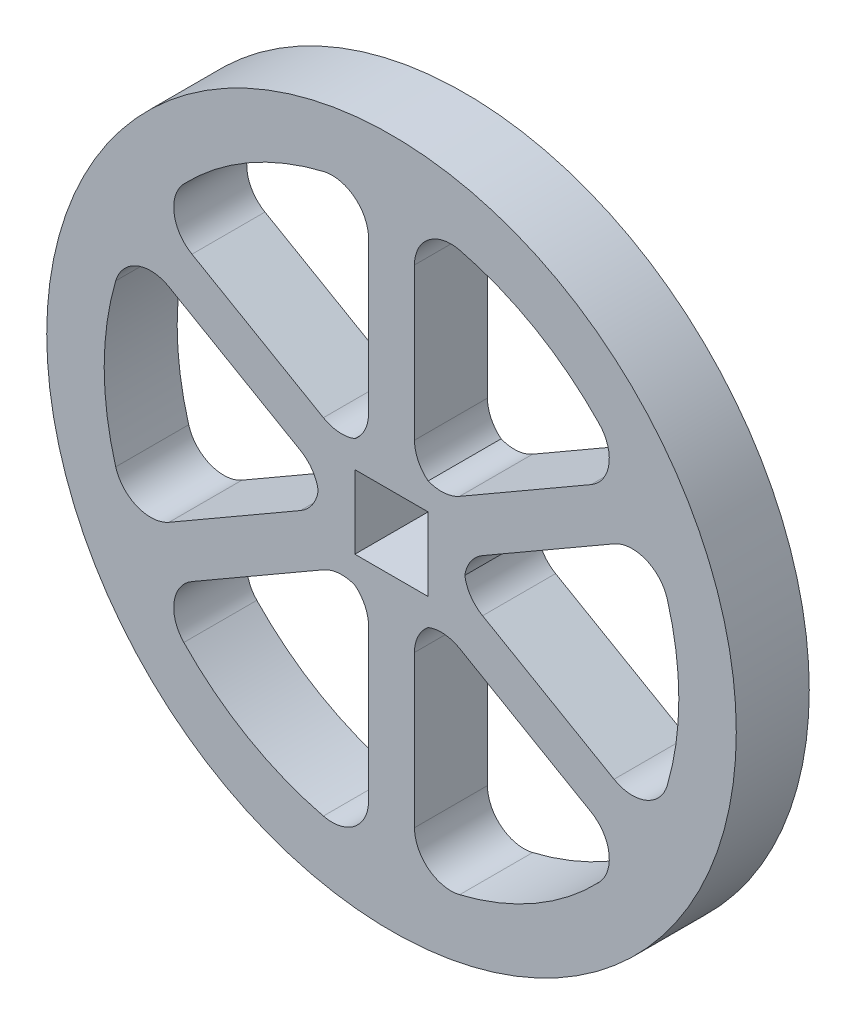
from build123d import *

# Parameters (mm, degrees)
SKETCH1_R           = 30
BOSS_EXTRUDE1_DEPTH = 6.35
FILLET1_R           = 3.175
SKETCH2_W           = 6.3754
SKETCH2_H           = 6.3754
CUT_EXTRUDE1_DEPTH  = 17.462


with BuildPart() as part:
    # Sketch1 → Boss-Extrude1 (new body)
    with BuildSketch(Plane.XY):
        Circle(SKETCH1_R)
        with BuildLine():
            Line((-2, 24.919871589), (-2, 6.026815079))
            ThreePointArc((-2, 6.026815079), (-3.175, 5.499261314), (-4.219374963, 4.745458347))
            Line((-4.219374963, 4.745458347), (-20.581241855, 14.191986602))
            ThreePointArc((-20.581241855, 14.191986602), (-12.5, 21.650635095), (-2, 24.919871589))
        make_face(mode=Mode.SUBTRACT)
        with BuildLine():
            Line((-22.581241855, 10.727884987), (-6.219374963, 1.281356732))
            ThreePointArc((-6.219374963, 1.281356732), (-6.35, 0), (-6.219374963, -1.281356732))
            Line((-6.219374963, -1.281356732), (-22.581241855, -10.727884987))
            ThreePointArc((-22.581241855, -10.727884987), (-25, 0), (-22.581241855, 10.727884987))
        make_face(mode=Mode.SUBTRACT)
        with BuildLine():
            Line((-20.581241855, -14.191986602), (-4.219374963, -4.745458347))
            ThreePointArc((-4.219374963, -4.745458347), (-3.175, -5.499261314), (-2, -6.026815079))
            Line((-2, -6.026815079), (-2, -24.919871589))
            ThreePointArc((-2, -24.919871589), (-12.5, -21.650635095), (-20.581241855, -14.191986602))
        make_face(mode=Mode.SUBTRACT)
        with BuildLine():
            Line((2, -24.919871589), (2, -6.026815079))
            ThreePointArc((2, -6.026815079), (3.175, -5.499261314), (4.219374963, -4.745458347))
            Line((4.219374963, -4.745458347), (20.581241855, -14.191986602))
            ThreePointArc((20.581241855, -14.191986602), (12.5, -21.650635095), (2, -24.919871589))
        make_face(mode=Mode.SUBTRACT)
        with BuildLine():
            Line((22.581241855, -10.727884987), (6.219374963, -1.281356732))
            ThreePointArc((6.219374963, -1.281356732), (6.35, 0), (6.219374963, 1.281356732))
            Line((6.219374963, 1.281356732), (22.581241855, 10.727884987))
            ThreePointArc((22.581241855, 10.727884987), (25, 0), (22.581241855, -10.727884987))
        make_face(mode=Mode.SUBTRACT)
        with BuildLine():
            Line((20.581241855, 14.191986602), (4.219374963, 4.745458347))
            ThreePointArc((4.219374963, 4.745458347), (3.175, 5.499261314), (2, 6.026815079))
            Line((2, 6.026815079), (2, 24.919871589))
            ThreePointArc((2, 24.919871589), (12.5, 21.650635095), (20.581241855, 14.191986602))
        make_face(mode=Mode.SUBTRACT)
    extrude(amount=BOSS_EXTRUDE1_DEPTH)

    # Fillet1
    # the kernel refuses this fillet: 3.175 mm, written as the material it adds along each edge
    with BuildSketch(Plane(origin=(-22.581241855, -10.727884987, 0), x_dir=(-0.3558834781816715, 0.9345303365634076, 0), z_dir=(0, 0, 1)), Plane(origin=(22.581241855, 10.727884987, 0), x_dir=(0.3558834781815518, -0.9345303365634531, 0), z_dir=(0, 0, 1)), Plane(origin=(-20.581241855, 14.191986602, 0), x_dir=(0.63138527298033, 0.7754693011741691, 0), z_dir=(0, 0, 1))) as fillet1_piece_1:
        with BuildLine():
            CenterArc((3.725852278, -3.164933037), FILLET1_R, 85.436166165, 103.716233406)
            Line((0.591273993, -3.669951824), (0, 0))
            ThreePointArc((0, 0), (1.989243074, 0.079267427), (3.978486149, 0))
        make_face()
    extrude(amount=6.35)
    with BuildSketch(Plane(origin=(-22.581241855, 10.727884987, 0), x_dir=(-0.3558834781816212, -0.9345303365634268, 0), z_dir=(0, 0, 1)), Plane(origin=(2, -24.919871589, 0), x_dir=(0.987268751161949, 0.1590610353893298, 0), z_dir=(0, 0, 1)), Plane(origin=(22.581241855, -10.727884987, 0), x_dir=(0.35588347818151106, 0.9345303365634686, 0), z_dir=(0, 0, 1)), Plane(origin=(-2, 24.919871589, 0), x_dir=(-0.9872687511619511, -0.15906103538931676, 0), z_dir=(0, 0, 1))) as fillet1_piece_2:
        with BuildLine():
            CenterArc((3.725852278, 3.164933037), FILLET1_R, 170.847600429, 103.716233406)
            Line((0.591273993, 3.669951824), (0, 0))
            ThreePointArc((0, 0), (1.989243074, -0.079267427), (3.978486149, 0))
        make_face()
    extrude(amount=6.35)
    with BuildSketch(Plane(origin=(-20.581241855, -14.191986602, 0), x_dir=(0.8660254037844406, 0.49999999999999667, 0), z_dir=(0, 0, 1)), Plane(origin=(20.581241855, 14.191986602, 0), x_dir=(-0.8660254037844309, -0.5000000000000133, 0), z_dir=(0, 0, 1))) as fillet1_piece_3:
        with BuildLine():
            CenterArc((3.717277408, -3.175), FILLET1_R, 90, 103.716233406)
            ThreePointArc((0.632822126, -3.927835052), (0.23815281, -1.976525885), (0, 0))
            Line((0, 0), (3.717277408, 0))
        make_face()
    extrude(amount=6.35)
    with BuildSketch(Plane(origin=(-2, -24.919871589, 0), x_dir=(0, 1, 0), z_dir=(0, 0, 1)), Plane(origin=(20.581241855, -14.191986602, 0), x_dir=(-0.8660254037844468, 0.49999999999998584, 0), z_dir=(0, 0, 1)), Plane(origin=(2, 24.919871589, 0), x_dir=(0, -1, 0), z_dir=(0, 0, 1))) as fillet1_piece_4:
        with BuildLine():
            CenterArc((3.717277408, 3.175), FILLET1_R, 166.283766594, 103.716233406)
            ThreePointArc((0.632822126, 3.927835052), (0.23815281, 1.976525885), (0, 0))
            Line((0, 0), (3.717277408, 0))
        make_face()
    extrude(amount=6.35)
    with BuildSketch(Plane(origin=(4.219374963, 4.745458347, 0), x_dir=(0.8660254037844292, 0.5000000000000164, 0), z_dir=(0, 0, 1)), Plane(origin=(6.219374963, -1.281356732, 0), x_dir=(0.8660254037845205, -0.4999999999998582, 0), z_dir=(0, 0, 1)), Plane(origin=(2, -6.026815079, 0), x_dir=(0, -1, 0), z_dir=(0, 0, 1)), Plane(origin=(-2, 6.026815079, 0), x_dir=(0, 1, 0), z_dir=(0, 0, 1)), Plane(origin=(-6.219374963, 1.281356732, 0), x_dir=(-0.866025403784444, 0.49999999999999056, 0), z_dir=(0, 0, 1)), Plane(origin=(-4.219374963, -4.745458347, 0), x_dir=(-0.8660254037844402, -0.49999999999999745, 0), z_dir=(0, 0, 1))) as fillet1_piece_5:
        with BuildLine():
            CenterArc((1.969746682, 3.175), FILLET1_R, 212.909051607, 57.090948393)
            ThreePointArc((-0.695773905, 1.45), (-0.301795458, 0.747116731), (0, 0))
            Line((0, 0), (1.969746682, 0))
        make_face()
    extrude(amount=6.35)
    with BuildSketch(Plane(origin=(2, 6.026815079, 0), x_dir=(0.9015778931723624, -0.43261680797546975, 0), z_dir=(0, 0, 1)), Plane(origin=(6.219374963, 1.281356732, 0), x_dir=(0.07613180077529093, -0.9970977629654534, 0), z_dir=(0, 0, 1)), Plane(origin=(-4.219374963, 4.745458347, 0), x_dir=(0.8254460923970771, 0.5644809549899766, 0), z_dir=(0, 0, 1)), Plane(origin=(-6.219374963, -1.281356732, 0), x_dir=(-0.07613180077550848, 0.9970977629654367, 0), z_dir=(0, 0, 1)), Plane(origin=(-2, -6.026815079, 0), x_dir=(-0.9015778931724164, 0.432616807975357, 0), z_dir=(0, 0, 1))) as fillet1_piece_6:
        with BuildLine():
            CenterArc((2.010364289, 3.149438429), FILLET1_R, 205.633744341, 57.090948393)
            Line((-0.852145522, 1.775880064), (0, 0))
            ThreePointArc((0, 0), (0.804145716, 0.051123142), (1.608291431, 0))
        make_face()
    extrude(amount=6.35)
    with BuildSketch(Plane(origin=(4.219374963, -4.745458347, 0), x_dir=(0.8660254037844309, -0.5000000000000133, 0), z_dir=(0, 0, 1))) as fillet1_piece_7:
        with BuildLine():
            CenterArc((1.969746682, -3.175), FILLET1_R, 90, 57.090948393)
            ThreePointArc((-0.695773905, -1.45), (-0.301795458, -0.747116731), (0, 0))
            Line((0, 0), (1.969746682, 0))
        make_face()
    extrude(amount=6.35)

    # Sketch2 → Cut-Extrude1 (cut)
    with BuildSketch(Plane(origin=(0, 0, 0), x_dir=(-1, 0, 0), z_dir=(0, 0, -1))):
        Rectangle(SKETCH2_W, SKETCH2_H)
    extrude(amount=-CUT_EXTRUDE1_DEPTH, mode=Mode.SUBTRACT)


solid = part.part
